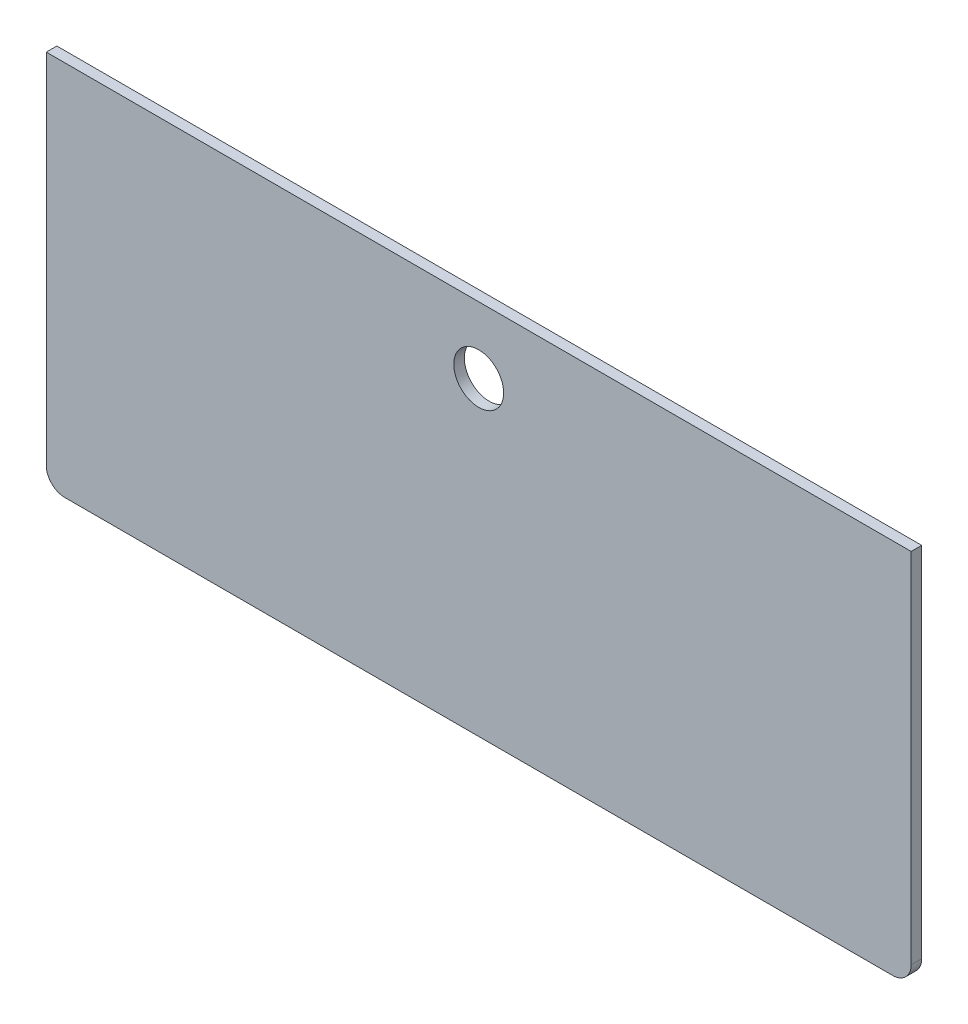
from build123d import *

# Parameters (mm, degrees)
SKETCH1_W           = 260
SKETCH1_H           = 113.175
SKETCH1_R           = 7.5
BOSS_EXTRUDE1_DEPTH = 3.175
FILLET1_R           = 5.55625


with BuildPart() as part:
    # Sketch1 → Boss-Extrude1 (new body)
    with BuildSketch(Plane.XY):
        with Locations((-26.765375854, -29.400711845)):
            Rectangle(SKETCH1_W, SKETCH1_H)
        with Locations((-26.765375854, 7.186788155)):
            Circle(SKETCH1_R, mode=Mode.SUBTRACT)
    extrude(amount=BOSS_EXTRUDE1_DEPTH)

    # Fillet1
    fillet1_edges = [part.edges().sort_by_distance(p)[0] for p in [
        (-156.765375854, -85.988211845, 1.5875),
        (103.234624146, -85.988211845, 1.5875),
    ]]
    fillet(fillet1_edges, radius=FILLET1_R)


solid = part.part
